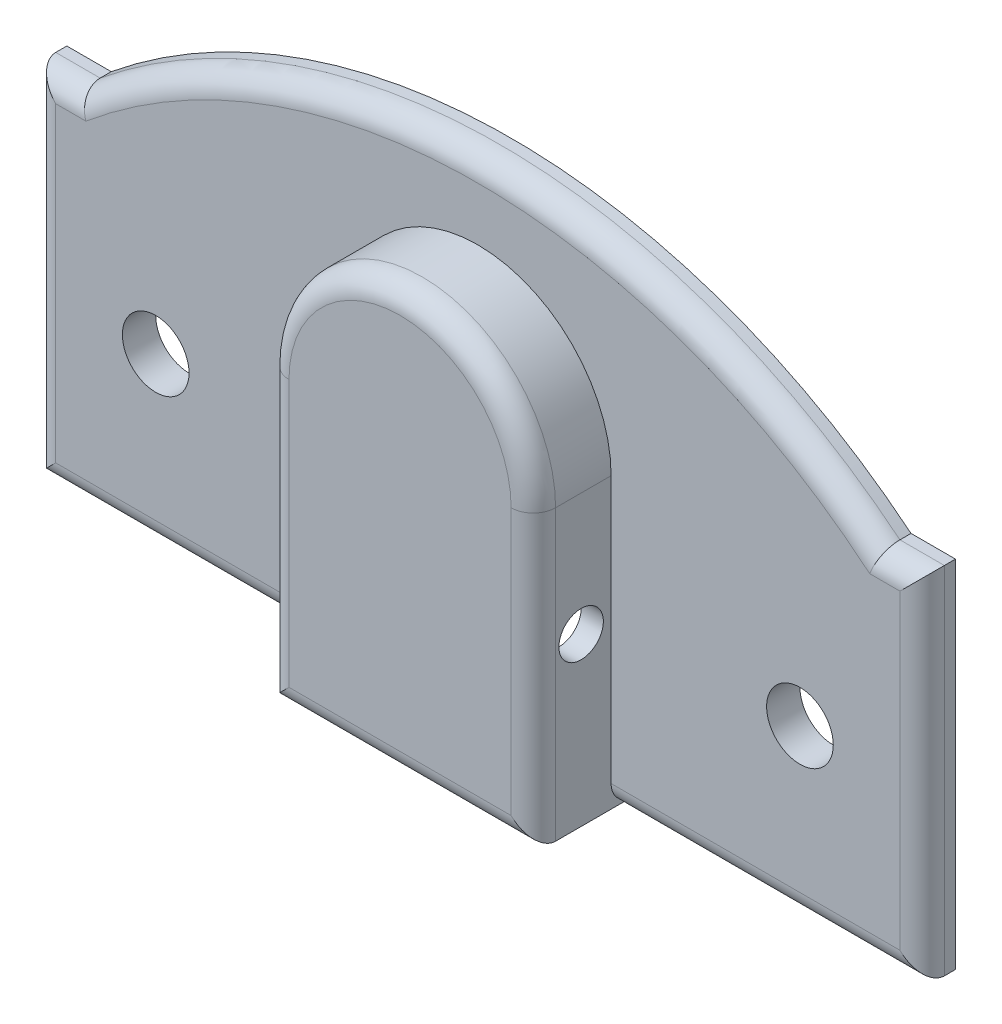
from build123d import *

# Parameters (mm, degrees)
BOSS_EXTRUDE1_DEPTH = 1.5
BOSS_EXTRUDE2_DEPTH = 3.5
CUT_EXTRUDE1_DEPTH  = 4
FILLET1_R           = 1
FILLET4_R           = 1
SKETCH5_R           = 1.5
CUT_EXTRUDE3_DEPTH  = 12
SKETCH4_R           = 1
CUT_EXTRUDE5_DEPTH  = 20


with BuildPart() as part:
    # Sketch1 → Boss-Extrude1 (new body)
    with BuildSketch(Plane.XY):
        with BuildLine():
            Line((0, 0), (20, 0))
            Line((20, 0), (20, 16))
            Line((20, 16), (18, 16))
            ThreePointArc((18, 16), (0, 22.408858912), (-18, 16))
            Line((-18, 16), (-20, 16))
            Line((-20, 16), (-20, 0))
            Line((-20, 0), (0, 0))
        make_face()
    extrude(amount=BOSS_EXTRUDE1_DEPTH)

    # Sketch2 → Boss-Extrude2 (add)
    with BuildSketch(Plane.XY.offset(1.5)):
        with BuildLine():
            Line((6, 0), (6, 13))
            ThreePointArc((6, 13), (0, 19), (-6, 13))
            Line((-6, 13), (-6, 0))
            Line((-6, 0), (6, 0))
        make_face()
    extrude(amount=BOSS_EXTRUDE2_DEPTH)

    # Sketch3 → Cut-Extrude1 (cut)
    with BuildSketch(Plane(origin=(0, 0, 0), x_dir=(-1, 0, 0), z_dir=(0, 0, -1))):
        with BuildLine():
            Line((0, 0), (5, 0))
            Line((5, 0), (5, 12))
            ThreePointArc((5, 12), (0, 17), (-5, 12))
            Line((-5, 12), (-5, 0))
            Line((-5, 0), (0, 0))
        make_face()
    extrude(amount=-CUT_EXTRUDE1_DEPTH, mode=Mode.SUBTRACT)

    # Fillet1
    fillet1_edges = [part.edges().sort_by_distance(p)[0] for p in [
        (-6, 6.5, 5),
        (0, 19, 5),
        (0, 0, 5),
        (6, 6.5, 5),
    ]]
    fillet(fillet1_edges, radius=FILLET1_R - 0.0001)  # a hair under: the kernel refuses the full size

    # Fillet4
    fillet4_edges = [part.edges().sort_by_distance(p)[0] for p in [
        (20, 8, 1.5),
        (19, 16, 1.5),
        (0, 22.408858912, 1.5),
        (13, 0, 1.5),
        (-19, 16, 1.5),
        (-20, 8, 1.5),
        (-13, 0, 1.5),
    ]]
    fillet(fillet4_edges, radius=FILLET4_R)

    # Sketch5 → Cut-Extrude3 (cut)
    with BuildSketch(Plane.XY.offset(1.5)):
        with Locations((14.499595769, 7.5)):
            Circle(SKETCH5_R)
        with Locations((-14.499595769, 7.5)):
            Circle(SKETCH5_R)
    extrude(amount=-CUT_EXTRUDE3_DEPTH, mode=Mode.SUBTRACT)

    # Sketch4 → Cut-Extrude5 (cut)
    with BuildSketch(Plane.ZY.offset(6)):
        with Locations((2.85, 7.5)):
            Circle(SKETCH4_R)
    extrude(amount=-CUT_EXTRUDE5_DEPTH, mode=Mode.SUBTRACT)


solid = part.part
